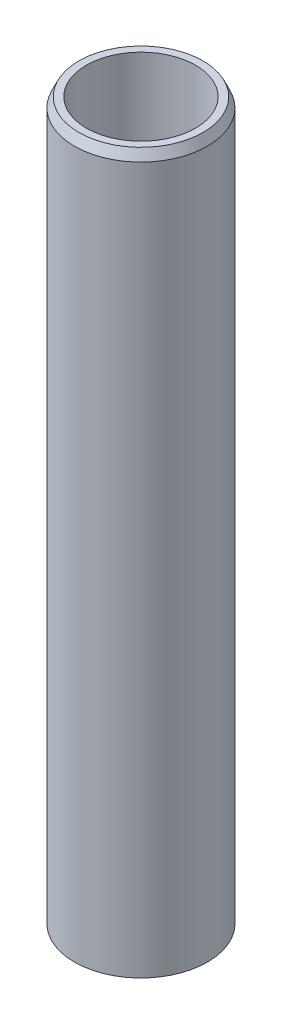
from build123d import *
from OCP.BRepFilletAPI import BRepFilletAPI_MakeChamfer

# Parameters (mm, degrees)
SKETCH1_R           = 35
BOSS_EXTRUDE1_DEPTH = 379.182196114
SKETCH2_R           = 28.717883458
CUT_EXTRUDE1_DEPTH  = 383.399186518
CHAMFER1_SIZE       = 5.081628528
CHAMFER1_SIZE2      = 2.348298891


with BuildPart() as part:
    # Sketch1 → Boss-Extrude1 (new body)
    with BuildSketch(Plane(origin=(0, 0, 0), x_dir=(1, 0, 0), z_dir=(0, 1, 0))):
        Circle(SKETCH1_R)
    extrude(amount=BOSS_EXTRUDE1_DEPTH)

    # Sketch2 → Cut-Extrude1 (cut, through all)
    with BuildSketch(Plane(origin=(0, 0, 0), x_dir=(1, 0, 0), z_dir=(0, 1, 0))):
        Circle(SKETCH2_R)
    extrude(amount=CUT_EXTRUDE1_DEPTH, mode=Mode.SUBTRACT)

    # Chamfer1: one chamfer whose edges measure the first distance from different faces: ONE call of the kernel's chamfer builder (chamfer() names one face for all edges)
    chamfer1_edges_1 = [part.edges().sort_by_distance(p)[0] for p in [
        (-35, 379.182196114, 0),
    ]]
    chamfer1_side_1 = [part.faces().sort_by_distance(p)[0] for p in [
        (-35, 189.591098057, 0),
    ]]
    chamfer1_edges_2 = [part.edges().sort_by_distance(p)[0] for p in [
        (-35, 0, 0),
    ]]
    chamfer1_side_2 = [part.faces().sort_by_distance(p)[0] for p in [
        (-34.010050506, 0, 0),
    ]]
    chamfer1 = BRepFilletAPI_MakeChamfer(part.part.solid().wrapped)
    for e in chamfer1_edges_1:
        chamfer1.Add(CHAMFER1_SIZE, CHAMFER1_SIZE2, e.wrapped, chamfer1_side_1[0].wrapped)  # the first distance lies on this face
    for e in chamfer1_edges_2:
        chamfer1.Add(CHAMFER1_SIZE, CHAMFER1_SIZE2, e.wrapped, chamfer1_side_2[0].wrapped)  # the first distance lies on this face
    add(Compound.cast(chamfer1.Shape()), mode=Mode.REPLACE)


solid = part.part
